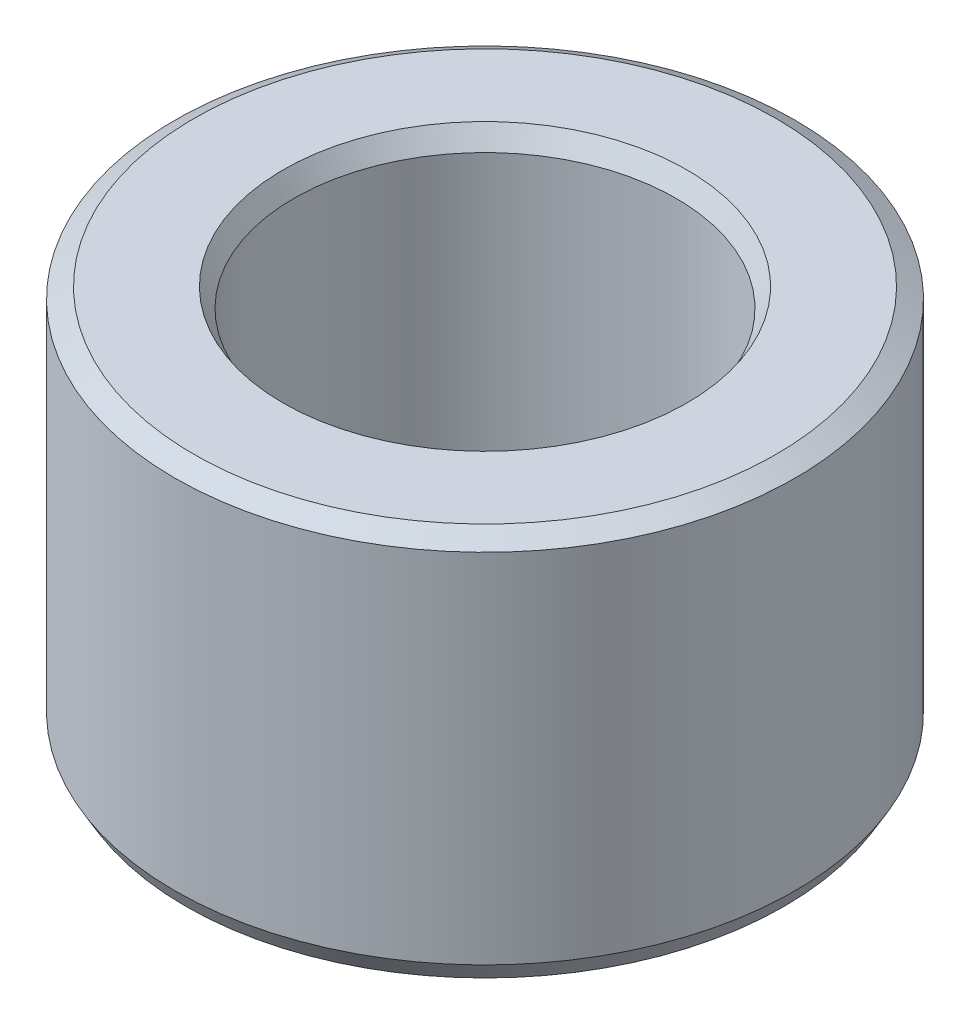
from build123d import *
from OCP.BRepFilletAPI import BRepFilletAPI_MakeChamfer

# Parameters (mm, degrees)
SKETCH1_R           = 50
BOSS_EXTRUDE1_DEPTH = 62.475041745
SKETCH2_R           = 30.790057925
CUT_EXTRUDE1_DEPTH  = 95.356403286
CHAMFER1_SIZE       = 1.775389807
CHAMFER1_SIZE2      = 3.07506535


with BuildPart() as part:
    # Sketch1 → Boss-Extrude1 (new body)
    with BuildSketch(Plane(origin=(0, 0, 0), x_dir=(1, 0, 0), z_dir=(0, 1, 0))):
        Circle(SKETCH1_R)
    extrude(amount=BOSS_EXTRUDE1_DEPTH)

    # Sketch2 → Cut-Extrude1 (cut, through all)
    with BuildSketch(Plane(origin=(0, 0, 0), x_dir=(1, 0, 0), z_dir=(0, 1, 0))):
        Circle(SKETCH2_R)
    extrude(amount=CUT_EXTRUDE1_DEPTH, mode=Mode.SUBTRACT)

    # Chamfer1: one chamfer whose edges measure the first distance from different faces: ONE call of the kernel's chamfer builder (chamfer() names one face for all edges)
    chamfer1_edges_1 = [part.edges().sort_by_distance(p)[0] for p in [
        (-30.790057925, 62.475041745, 0),
    ]]
    chamfer1_side_1 = [part.faces().sort_by_distance(p)[0] for p in [
        (-48.585786438, 62.475041745, 0),
    ]]
    chamfer1_edges_2 = [part.edges().sort_by_distance(p)[0] for p in [
        (-30.790057925, 0, 0),
    ]]
    chamfer1_side_2 = [part.faces().sort_by_distance(p)[0] for p in [
        (-30.790057925, 31.237520872, 0),
    ]]
    chamfer1_edges_3 = [part.edges().sort_by_distance(p)[0] for p in [
        (-50, 0, 0),
    ]]
    chamfer1_side_3 = [part.faces().sort_by_distance(p)[0] for p in [
        (-48.585786438, 0, 0),
    ]]
    chamfer1_edges_4 = [part.edges().sort_by_distance(p)[0] for p in [
        (-50, 62.475041745, 0),
    ]]
    chamfer1_side_4 = [part.faces().sort_by_distance(p)[0] for p in [
        (-50, 31.237520872, 0),
    ]]
    chamfer1 = BRepFilletAPI_MakeChamfer(part.part.solid().wrapped)
    for e in chamfer1_edges_1:
        chamfer1.Add(CHAMFER1_SIZE, CHAMFER1_SIZE2, e.wrapped, chamfer1_side_1[0].wrapped)  # the first distance lies on this face
    for e in chamfer1_edges_2:
        chamfer1.Add(CHAMFER1_SIZE, CHAMFER1_SIZE2, e.wrapped, chamfer1_side_2[0].wrapped)  # the first distance lies on this face
    for e in chamfer1_edges_3:
        chamfer1.Add(CHAMFER1_SIZE, CHAMFER1_SIZE2, e.wrapped, chamfer1_side_3[0].wrapped)  # the first distance lies on this face
    for e in chamfer1_edges_4:
        chamfer1.Add(CHAMFER1_SIZE, CHAMFER1_SIZE2, e.wrapped, chamfer1_side_4[0].wrapped)  # the first distance lies on this face
    add(Compound.cast(chamfer1.Shape()), mode=Mode.REPLACE)


solid = part.part
